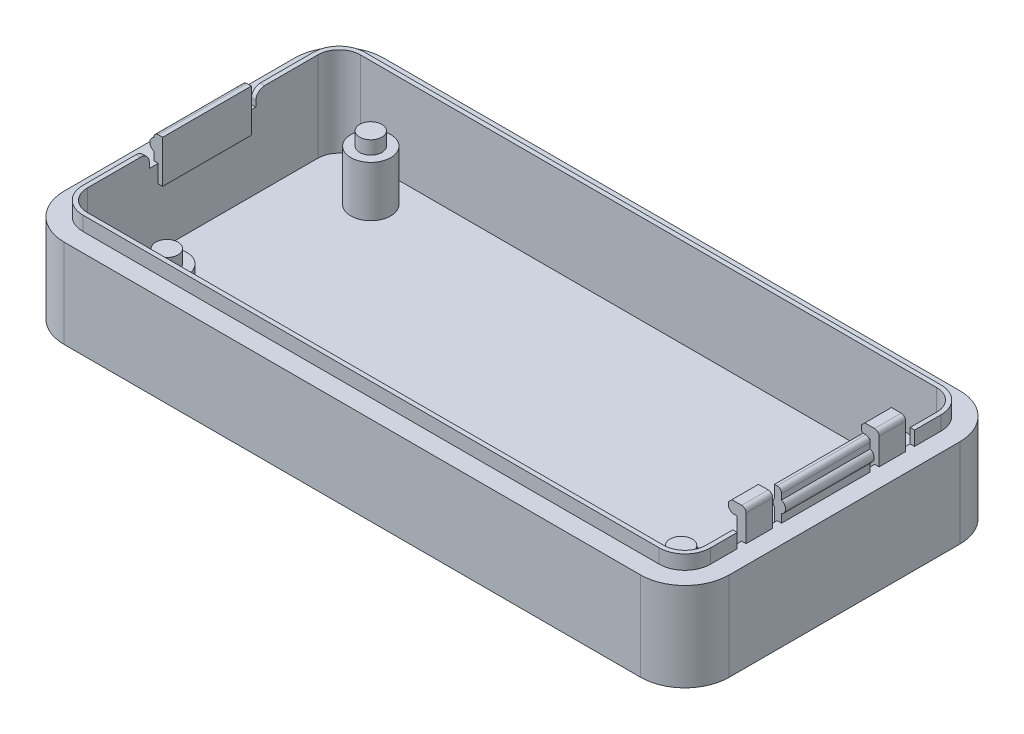
from build123d import *

# Parameters (mm, degrees)
EXTRUDE_2_DEPTH       = 10
EXTRUDE_4_DEPTH       = 1.6
SKETCH_7_W            = 0.5
SKETCH_7_H            = 10
EXTRUDE_8_DEPTH       = 2.8
SKETCH_8_R            = 0.7
EXTRUDE_9_DEPTH       = 10
FILLET_1_R            = 0.5
SKETCH_11_W           = 1
SKETCH_11_H           = 1.6
CUT_EXTRUDE_1_DEPTH   = 1.2
FILLET_2_R            = 1
SKETCH_13_W           = 0.5
SKETCH_13_H           = 10
EXTRUDE_10_DEPTH      = 2.8
CUT_EXTRUDE_START     = -8.5
CUT_EXTRUDE_2_DEPTH   = 8.5
SKETCH_13_2_W         = 0.5
SKETCH_13_2_H         = 10
EXTRUDE_11_DEPTH      = 2
EXTRUDE_12_DEPTH      = 1.6
EXTRUDE_12_DEPTH_BACK = 2
SKETCH_5_W            = 0.3
SKETCH_5_H            = 10
SKETCH_15_R           = 2.25
EXTRUDE_13_DEPTH      = 5.7
SKETCH_16_R           = 1.25
EXTRUDE_14_DEPTH      = 1.5
SKETCH_17_W           = 0.5
SKETCH_17_H           = 1
CUT_EXTRUDE_3_DEPTH   = 1.6
SKETCH_19_W           = 0.8
SKETCH_19_H           = 10
EXTRUDE_15_DEPTH      = 1.8
SKETCH_20_R           = 0.7
EXTRUDE_16_DEPTH      = 10
FILLET_4_R            = 0.5
SKETCH_21_W           = 0.5
SKETCH_21_H           = 3
EXTRUDE_17_DEPTH      = 1.9
SKETCH_22_W           = 3
SKETCH_22_H           = 6.3
EXTRUDE_23_DEPTH      = 0.5
FILLET_12_R           = 0.5
SKETCH_29_W           = 0.5
SKETCH_29_H           = 1
CUT_EXTRUDE_5_DEPTH   = 1.6
SKETCH_30_W           = 3
SKETCH_30_H           = 1.3
EXTRUDE_26_DEPTH      = 1
CHAMFER_7_SIZE        = 0.4


with BuildPart() as part:
    # case 2 → 凸台-拉伸2 (new body)
    with BuildSketch(Plane(origin=(0, 0, 0), x_dir=(1, 0, 0), z_dir=(0, 1, 0))):
        with BuildLine():
            Line((-34.042196447, 18), (30.957803553, 18))
            ThreePointArc((30.957803553, 18), (34.493337459, 16.535533906), (35.957803553, 13))
            Line((35.957803553, 13), (35.957803553, -13))
            ThreePointArc((35.957803553, -13), (34.493337459, -16.535533906), (30.957803553, -18))
            Line((30.957803553, -18), (-34.042196447, -18))
            ThreePointArc((-34.042196447, -18), (-37.577730353, -16.535533906), (-39.042196447, -13))
            Line((-39.042196447, -13), (-39.042196447, 13))
            ThreePointArc((-39.042196447, 13), (-37.577730353, 16.535533906), (-34.042196447, 18))
        make_face()
    extrude(amount=EXTRUDE_2_DEPTH)

    # 草图3 → 凸台-拉伸4 (add)
    with BuildSketch(Plane(origin=(0, 10, 0), x_dir=(1, 0, 0), z_dir=(0, 1, 0))):
        with BuildLine():
            Line((-36.942196447, 13), (-36.942196447, -13))
            ThreePointArc((-36.942196447, -13), (-36.092806113, -15.050609665), (-34.042196447, -15.9))
            Line((-34.042196447, -15.9), (30.957803553, -15.9))
            ThreePointArc((30.957803553, -15.9), (33.008413218, -15.050609665), (33.857803553, -13))
            Line((33.857803553, -13), (33.857803553, 13))
            ThreePointArc((33.857803553, 13), (33.008413218, 15.050609665), (30.957803553, 15.9))
            Line((30.957803553, 15.9), (-34.042196447, 15.9))
            ThreePointArc((-34.042196447, 15.9), (-36.092806113, 15.050609665), (-36.942196447, 13))
        make_face()
        with BuildLine():
            Line((-34.042196447, -15.4), (30.957803553, -15.4))
            ThreePointArc((30.957803553, -15.4), (32.654859828, -14.697056275), (33.357803553, -13))
            Line((33.357803553, -13), (33.357803553, 13))
            ThreePointArc((33.357803553, 13), (32.654859828, 14.697056275), (30.957803553, 15.4))
            Line((30.957803553, 15.4), (-34.042196447, 15.4))
            ThreePointArc((-34.042196447, 15.4), (-35.739252722, 14.697056275), (-36.442196447, 13))
            Line((-36.442196447, 13), (-36.442196447, -13))
            ThreePointArc((-36.442196447, -13), (-35.739252722, -14.697056275), (-34.042196447, -15.4))
        make_face(mode=Mode.SUBTRACT)
    extrude(amount=EXTRUDE_4_DEPTH)

    # 草图7 → 凸台-拉伸8 (add)
    with BuildSketch(Plane(origin=(0, 10, 0), x_dir=(1, 0, 0), z_dir=(0, 1, 0))):
        with Locations((-36.692196447, 0)):
            Rectangle(SKETCH_7_W, SKETCH_7_H)
    extrude(amount=EXTRUDE_8_DEPTH)

    # 草图8 → 凸台-拉伸9 (add)
    with BuildSketch(Plane.XY.offset(5)):
        with Locations((-36.692196447, 11.6)):
            Circle(SKETCH_8_R)
    extrude(amount=-EXTRUDE_9_DEPTH)

    # 圆角1
    fillet_1_edges = [part.edges().sort_by_distance(p)[0] for p in [
        (-36.942196447, 12.8, 0),
    ]]
    fillet(fillet_1_edges, radius=FILLET_1_R - 0.0001)  # a hair under: the kernel refuses the full size

    # 草图11 → 切除-拉伸1 (cut)
    with BuildSketch(Plane.ZY.offset(36.942196447)):
        with Locations((5.5, 10.8)):
            Rectangle(SKETCH_11_W, SKETCH_11_H)
        with Locations((-5.5, 10.8)):
            Rectangle(SKETCH_11_W, SKETCH_11_H)
    extrude(amount=-CUT_EXTRUDE_1_DEPTH, mode=Mode.SUBTRACT)

    # 圆角2
    fillet_2_edges = [part.edges().sort_by_distance(p)[0] for p in [
        (-36.692196447, 11.6, 6),
        (-36.692196447, 11.6, -6),
    ]]
    fillet(fillet_2_edges, radius=FILLET_2_R)

    # 草图13 → 凸台-拉伸10 (add)
    with BuildSketch(Plane(origin=(0, 10, 0), x_dir=(1, 0, 0), z_dir=(0, 1, 0))):
        with Locations((-36.192196447, 0)):
            Rectangle(SKETCH_13_W, SKETCH_13_H)
    extrude(amount=EXTRUDE_10_DEPTH)

    # 草图14 → 切除-拉伸2 (cut)
    with BuildSketch(Plane(origin=(0, 10, 0), x_dir=(1, 0, 0), z_dir=(0, 1, 0)).offset(CUT_EXTRUDE_START)):
        with BuildLine():
            Line((-34.042196447, -15.4), (30.957803553, -15.4))
            ThreePointArc((30.957803553, -15.4), (32.654859828, -14.697056275), (33.357803553, -13))
            Line((33.357803553, -13), (33.357803553, 13))
            ThreePointArc((33.357803553, 13), (32.654859828, 14.697056275), (30.957803553, 15.4))
            Line((30.957803553, 15.4), (-34.042196447, 15.4))
            ThreePointArc((-34.042196447, 15.4), (-35.739252722, 14.697056275), (-36.442196447, 13))
            Line((-36.442196447, 13), (-36.442196447, -13))
            ThreePointArc((-36.442196447, -13), (-35.739252722, -14.697056275), (-34.042196447, -15.4))
        make_face()
    extrude(amount=CUT_EXTRUDE_2_DEPTH, mode=Mode.SUBTRACT)

    # 草图13<2> → 凸台-拉伸11 (add)
    with BuildSketch(Plane(origin=(0, 10, 0), x_dir=(1, 0, 0), z_dir=(0, 1, 0))):
        with Locations((-36.192196447, 0)):
            Rectangle(SKETCH_13_2_W, SKETCH_13_2_H)
    extrude(amount=-EXTRUDE_11_DEPTH)

    # 草图5 → 凸台-拉伸12 (add, two sides: drawn at the far end of the back side and taken through both)
    with BuildSketch(Plane(origin=(0, 10, 0), x_dir=(1, 0, 0), z_dir=(0, 1, 0)).offset(-EXTRUDE_12_DEPTH_BACK)):
        with Locations((33.207803553, 0)):
            Rectangle(SKETCH_5_W, SKETCH_5_H)
    extrude(amount=EXTRUDE_12_DEPTH + EXTRUDE_12_DEPTH_BACK)

    # 草图15 → 凸台-拉伸13 (add)
    with BuildSketch(Plane(origin=(0, 1.5, 0), x_dir=(1, 0, 0), z_dir=(0, 1, 0))):
        with Locations(Location((29.060337171, -11.529492838, 0), (0, 0, 270))):
            Circle(SKETCH_15_R)
        with Locations(Location((-28.939662829, -11.529492838, 0), (0, 0, 270))):
            Circle(SKETCH_15_R)
        with Locations(Location((29.060337171, 11.470507162, 0), (0, 0, 270))):
            Circle(SKETCH_15_R)
        with Locations(Location((-28.939662829, 11.470507162, 0), (0, 0, 270))):
            Circle(SKETCH_15_R)
    extrude(amount=EXTRUDE_13_DEPTH)

    # 草图16 → 凸台-拉伸14 (add)
    with BuildSketch(Plane(origin=(0, 7.2, 0), x_dir=(1, 0, 0), z_dir=(0, 1, 0))):
        with Locations(Location((29.060337171, -11.529492838, 0), (0, 0, 270))):
            Circle(SKETCH_16_R)
        with Locations(Location((29.060337171, 11.470507162, 0), (0, 0, 270))):
            Circle(SKETCH_16_R)
        with Locations(Location((-28.939662829, -11.529492838, 0), (0, 0, 270))):
            Circle(SKETCH_16_R)
        with Locations(Location((-28.939662829, 11.470507162, 0), (0, 0, 270))):
            Circle(SKETCH_16_R)
    extrude(amount=EXTRUDE_14_DEPTH)

    # 草图17 → 切除-拉伸3 (cut)
    with BuildSketch(Plane(origin=(0, 11.6, 0), x_dir=(1, 0, 0), z_dir=(0, 1, 0))):
        with Locations((33.607803553, -5.5)):
            Rectangle(SKETCH_17_W, SKETCH_17_H)
        with Locations((33.607803553, 5.5)):
            Rectangle(SKETCH_17_W, SKETCH_17_H)
    extrude(amount=-CUT_EXTRUDE_3_DEPTH, mode=Mode.SUBTRACT)

    # 草图19 → 凸台-拉伸15 (add)
    with BuildSketch(Plane(origin=(0, 11.6, 0), x_dir=(1, 0, 0), z_dir=(0, 1, 0))):
        with Locations((33.457803553, 0)):
            Rectangle(SKETCH_19_W, SKETCH_19_H)
    extrude(amount=EXTRUDE_15_DEPTH)

    # 草图20 → 凸台-拉伸16 (add)
    with BuildSketch(Plane(origin=(0, 0, -5), x_dir=(-1, 0, 0), z_dir=(0, 0, -1))):
        with Locations((-33.607803553, 11.6)):
            Circle(SKETCH_20_R)
    extrude(amount=-EXTRUDE_16_DEPTH)

    # 圆角4
    fillet_4_edges = [part.edges().sort_by_distance(p)[0] for p in [
        (33.857803553, 13.4, 0),
    ]]
    fillet(fillet_4_edges, radius=FILLET_4_R)

    # 草图21 → 凸台-拉伸17 (add)
    with BuildSketch(Plane(origin=(0, 11.6, 0), x_dir=(1, 0, 0), z_dir=(0, 1, 0))):
        with Locations((33.607803553, -7.5)):
            Rectangle(SKETCH_21_W, SKETCH_21_H)
        with Locations((33.607803553, 7.5)):
            Rectangle(SKETCH_21_W, SKETCH_21_H)
    extrude(amount=EXTRUDE_17_DEPTH)

    # 草图22 → 凸台-拉伸23 (add)
    with BuildSketch(Plane.ZY.offset(-33.357803553)):
        with Locations((-7.5, 10.35)):
            Rectangle(SKETCH_22_W, SKETCH_22_H)
        with Locations((7.5, 10.35)):
            Rectangle(SKETCH_22_W, SKETCH_22_H)
    extrude(amount=EXTRUDE_23_DEPTH)

    # 圆角12
    fillet_12_edges = [part.edges().sort_by_distance(p)[0] for p in [
        (33.857803553, 13.5, 7.5),
        (33.857803553, 13.5, -7.5),
    ]]
    fillet(fillet_12_edges, radius=FILLET_12_R)

    # 草图29 → 切除-拉伸5 (cut)
    with BuildSketch(Plane(origin=(0, 11.6, 0), x_dir=(1, 0, 0), z_dir=(0, 1, 0))):
        with Locations((33.607803553, -9.5)):
            Rectangle(SKETCH_29_W, SKETCH_29_H)
        with Locations((33.607803553, 9.5)):
            Rectangle(SKETCH_29_W, SKETCH_29_H)
    extrude(amount=-CUT_EXTRUDE_5_DEPTH, mode=Mode.SUBTRACT)

    # 草图30 → 凸台-拉伸26 (add)
    with BuildSketch(Plane.ZY.offset(-32.857803553)):
        with Locations((7.5, 12.85)):
            Rectangle(SKETCH_30_W, SKETCH_30_H)
        with Locations((-7.5, 12.85)):
            Rectangle(SKETCH_30_W, SKETCH_30_H)
    extrude(amount=EXTRUDE_26_DEPTH)

    # 倒角7
    chamfer_7_edges = [part.edges().sort_by_distance(p)[0] for p in [
        (31.857803553, 12.2, 7.5),
        (31.857803553, 13.5, 7.5),
        (31.857803553, 12.2, -7.5),
        (31.857803553, 13.5, -7.5),
    ]]
    chamfer(chamfer_7_edges, length=CHAMFER_7_SIZE)


solid = part.part
